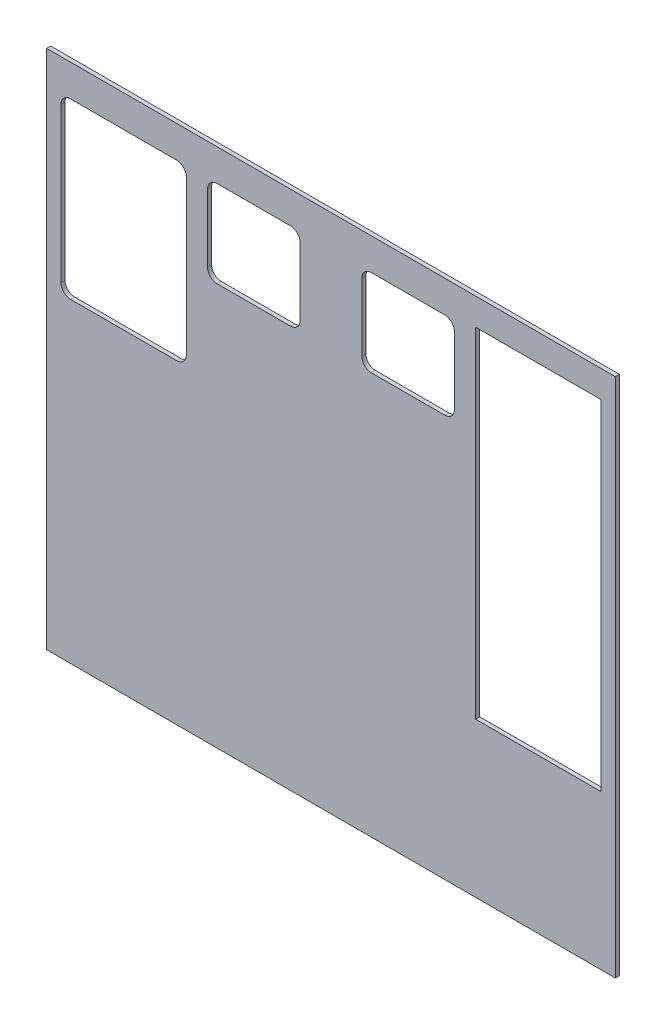
from build123d import *

# Parameters (mm, degrees)
SKETCH1_W                   = 82.55
SKETCH1_H                   = 223.52
BOSS_EXTRUDE1_DEPTH         = 2.667
CORNERRADIUSALLOWANCE_DEPTH = 408.419998422


with BuildPart() as part:
    # Sketch1 → Boss-Extrude1 (new body)
    with BuildSketch(Plane.XY):
        with BuildLine():
            Line((-193.04, 349.25), (-193.04, 0))
            Line((-193.04, 0), (193.04, 0))
            Line((193.04, 0), (193.04, 349.25))
            ThreePointArc((193.04, 349.25), (0, 358.775), (-193.04, 349.25))
        make_face()
        with BuildLine():
            ThreePointArc((-177.8, 315.595), (-175.940128061, 320.085128061), (-171.45, 321.945))
            Line((-171.45, 321.945), (-101.6, 321.945))
            ThreePointArc((-101.6, 321.945), (-97.109871939, 320.085128061), (-95.25, 315.595))
            Line((-95.25, 315.595), (-95.25, 213.995))
            ThreePointArc((-95.25, 213.995), (-97.109871939, 209.504871939), (-101.6, 207.645))
            Line((-101.6, 207.645), (-171.45, 207.645))
            ThreePointArc((-171.45, 207.645), (-175.940128061, 209.504871939), (-177.8, 213.995))
            Line((-177.8, 213.995), (-177.8, 315.595))
        make_face(mode=Mode.SUBTRACT)
        with BuildLine():
            ThreePointArc((-81.28, 315.595), (-79.420128061, 320.085128061), (-74.93, 321.945))
            Line((-74.93, 321.945), (-26.67, 321.945))
            ThreePointArc((-26.67, 321.945), (-22.179871939, 320.085128061), (-20.32, 315.595))
            Line((-20.32, 315.595), (-20.32, 271.145))
            ThreePointArc((-20.32, 271.145), (-22.179871939, 266.654871939), (-26.67, 264.795))
            Line((-26.67, 264.795), (-74.93, 264.795))
            ThreePointArc((-74.93, 264.795), (-79.420128061, 266.654871939), (-81.28, 271.145))
            Line((-81.28, 271.145), (-81.28, 315.595))
        make_face(mode=Mode.SUBTRACT)
        with BuildLine():
            Line((74.93, 264.795), (26.67, 264.795))
            ThreePointArc((26.67, 264.795), (22.179871939, 266.654871939), (20.32, 271.145))
            Line((20.32, 271.145), (20.32, 315.595))
            ThreePointArc((20.32, 315.595), (22.179871939, 320.085128061), (26.67, 321.945))
            Line((26.67, 321.945), (74.93, 321.945))
            ThreePointArc((74.93, 321.945), (79.420128061, 320.085128061), (81.28, 315.595))
            Line((81.28, 315.595), (81.28, 271.145))
            ThreePointArc((81.28, 271.145), (79.420128061, 266.654871939), (74.93, 264.795))
        make_face(mode=Mode.SUBTRACT)
        with Locations((136.525, 213.36)):
            Rectangle(SKETCH1_W, SKETCH1_H, mode=Mode.SUBTRACT)
    extrude(amount=BOSS_EXTRUDE1_DEPTH)

    # Sketch2 → CornerRadiusAllowance (cut, through all)
    with BuildSketch(Plane.XY.offset(2.667)):
        with BuildLine():
            Line((-187.198, 0), (-187.198, 342.9))
            Line((-187.198, 342.9), (187.198, 342.9))
            Line((187.198, 342.9), (187.198, 0))
            Line((187.198, 0), (193.04, 0))
            Line((193.04, 0), (193.04, 349.25))
            ThreePointArc((193.04, 349.25), (0, 358.775), (-193.04, 349.25))
            Line((-193.04, 349.25), (-193.04, 0))
            Line((-193.04, 0), (-187.198, 0))
        make_face()
    extrude(amount=-CORNERRADIUSALLOWANCE_DEPTH, mode=Mode.SUBTRACT)


solid = part.part
